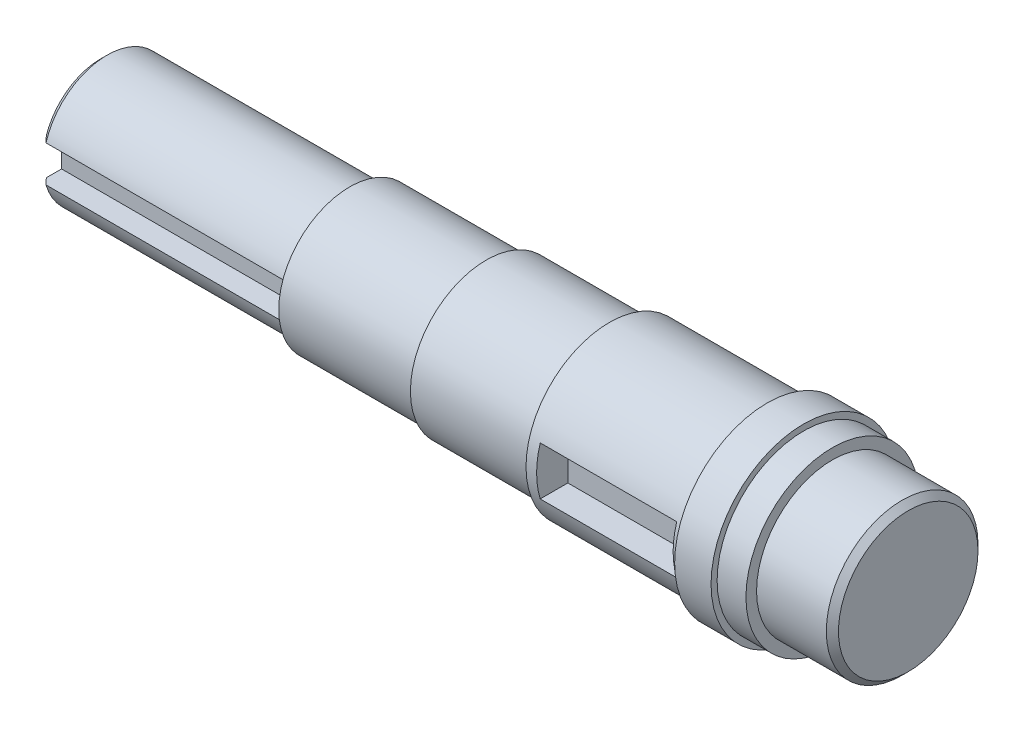
from build123d import *

# Parameters (mm, degrees)
CUT_EXTRUDE_START   = 17.2
SKETCH_9_W          = 45
SKETCH_9_H          = 8
CUT_EXTRUDE_1_DEPTH = 36
CUT_EXTRUDE_START_2 = 13
SKETCH_12_W         = 81
SKETCH_12_H         = 6
CUT_EXTRUDE_4_DEPTH = 35
CHAMFER_1_SIZE      = 2


# Read off the part's stored shape, not the designer's step: 旋转3
with BuildPart() as part:
    # 旋转3 outline → 旋转3 (revolve)
    with BuildSketch(Plane(origin=(0, -27.284213334, 0), x_dir=(0, 1, 0), z_dir=(0, 0, -1))):
        Polygon((25, 155.634128986), (0, 155.634128986), (0, -110.465871014), (21, -110.465871014), (21, -28.465871014), (23.4, -28.465871014), (23.4, 16.534128986), (25, 16.534128986), (25, 57.134128986), (27.5, 57.134128986), (27.5, 109.134128986), (30.5, 109.134128986), (30.5, 121.134128986), (28.5, 121.134128986), (28.5, 130.634128986), (25, 130.634128986), align=None)
    revolve(axis=Axis((0, -27.284213334, 0), (1, 0, 0)))

    # 草图9 → 切除-拉伸1 (cut)
    with BuildSketch(Plane.XY.offset(CUT_EXTRUDE_START)):
        with Locations((83.134128986, -23.284213334)):
            Rectangle(SKETCH_9_W, SKETCH_9_H)
        with Locations((83.134128986, -31.284213334)):
            Rectangle(SKETCH_9_W, SKETCH_9_H)
    extrude(amount=CUT_EXTRUDE_1_DEPTH, mode=Mode.SUBTRACT)

    # 草图12 → 切除-拉伸4 (cut)
    with BuildSketch(Plane.XY.offset(CUT_EXTRUDE_START_2)):
        with Locations((-69.965871014, -24.284213334)):
            Rectangle(SKETCH_12_W, SKETCH_12_H)
        with Locations((-69.965871014, -30.284213334)):
            Rectangle(SKETCH_12_W, SKETCH_12_H)
    extrude(amount=CUT_EXTRUDE_4_DEPTH, mode=Mode.SUBTRACT)

    # 倒角1
    chamfer_1_edges = [part.edges().sort_by_distance(p)[0] for p in [
        (-110.465871014, -39.834113732, -16.837458241),
        (155.634128986, -52.284213334, 0),
    ]]
    chamfer(chamfer_1_edges, length=CHAMFER_1_SIZE)


solid = part.part
